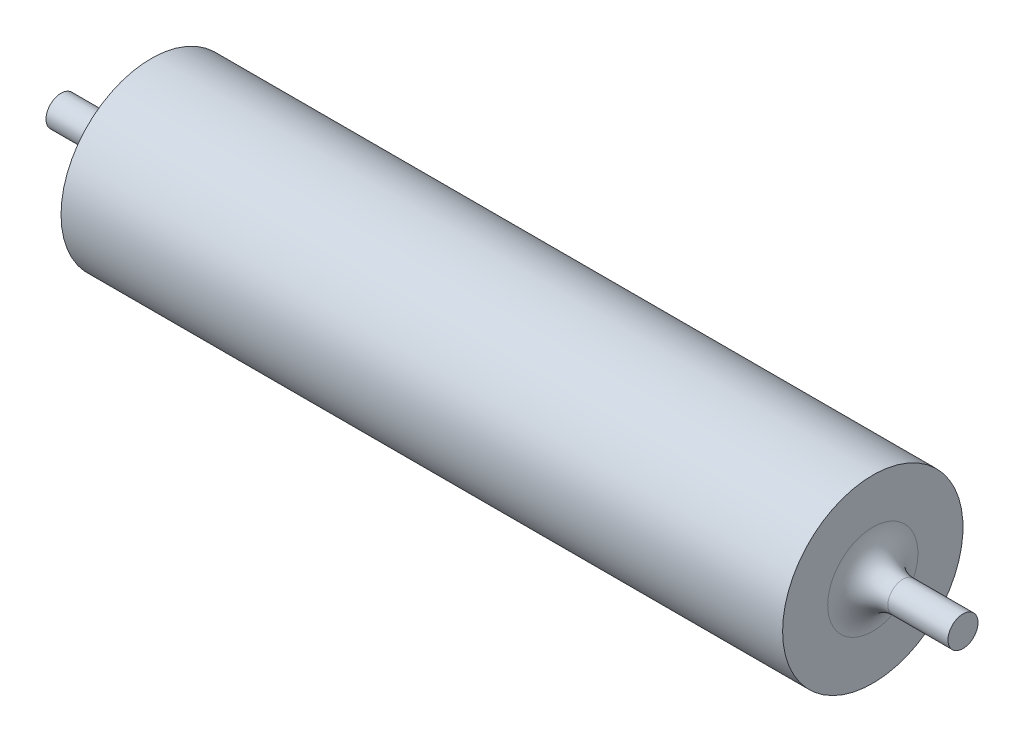
from build123d import *

# Parameters (mm, degrees)
CONG_1_R = 5


with BuildPart() as part:
    # Esquisse1 → Révolution1 (revolve)
    with BuildSketch(Plane.XY):
        Polygon((-75, 0), (-75, 2.5), (-60, 2.5), (-60, 15), (60, 15), (60, 2.5), (75, 2.5), (75, 0), align=None)
    revolve(axis=Axis((-75, 0, 0), (1, 0, 0)))

    # Congé1
    cong_1_edges = [part.edges().sort_by_distance(p)[0] for p in [
        (60, -2.5, 0),
        (-60, -2.5, 0),
    ]]
    fillet(cong_1_edges, radius=CONG_1_R)


solid = part.part
